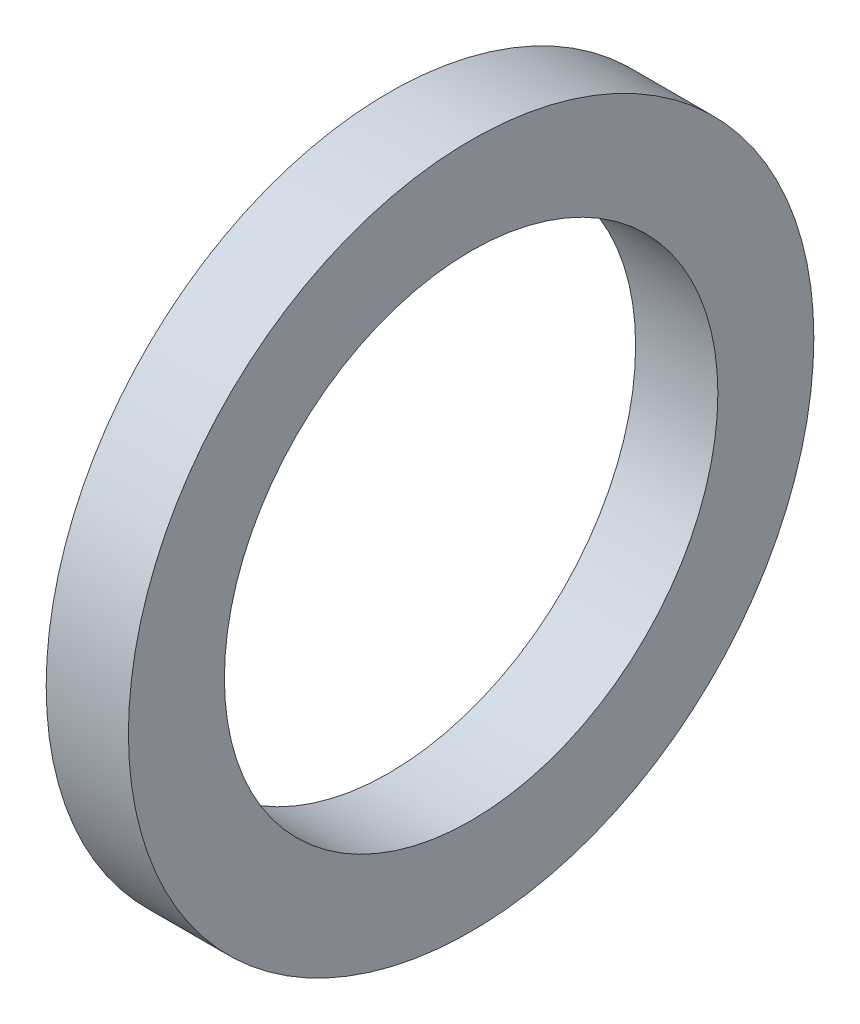
from build123d import *

# Parameters (mm, degrees)
SKETCH1_W = 6
SKETCH1_H = 7


with BuildPart() as part:
    # Sketch1 → Base-Revolve (revolve)
    with BuildSketch(Plane.XY):
        with Locations((-3, 21.5)):
            Rectangle(SKETCH1_W, SKETCH1_H)
    revolve(axis=Axis((-34.925, 0, 0), (1, 0, 0)))


solid = part.part
